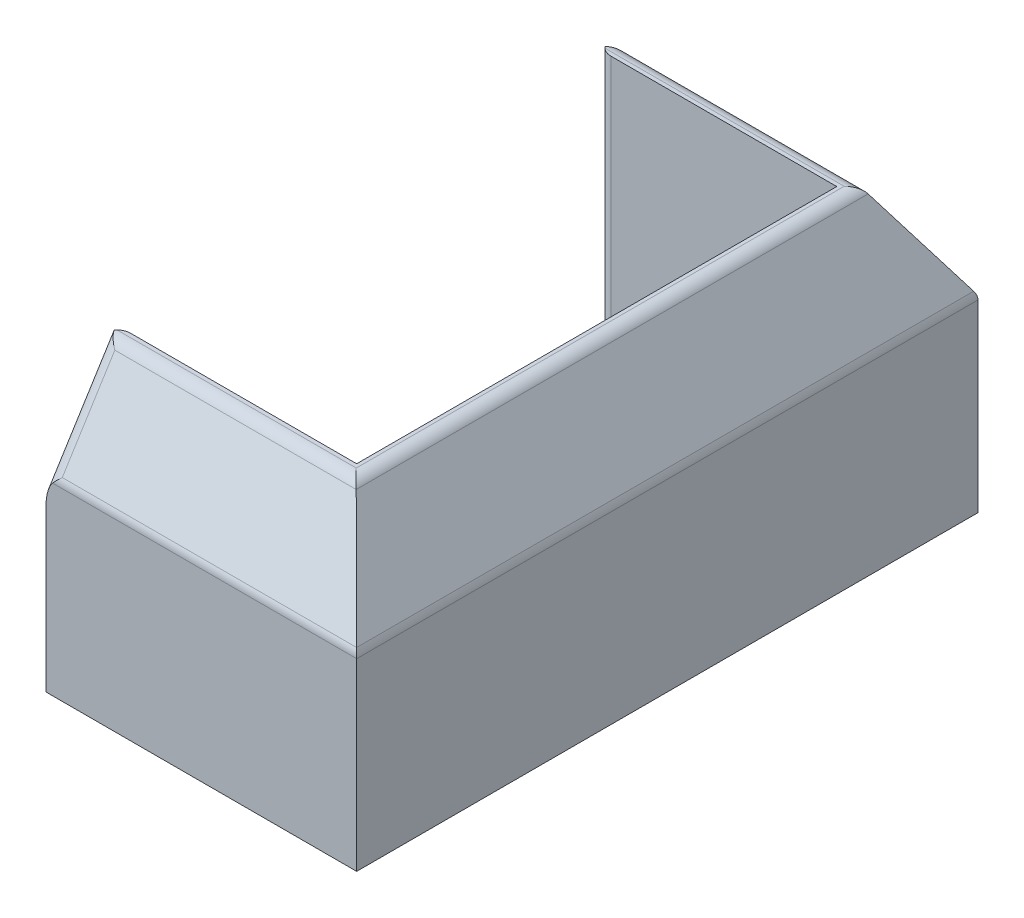
from build123d import *

# Parameters (mm, degrees)
BOSS_EXTRUDE1_DEPTH = 10.16
SKETCH2_W           = 11.43
SKETCH2_H           = 11.43
SKETCH2_R           = 2
BOSS_EXTRUDE2_DEPTH = 2.54
FILLET2_R           = 0.762


with BuildPart() as part:
    # Sketch1 → Boss-Extrude1 (new body)
    with BuildSketch(Plane(origin=(0, 0, 0), x_dir=(1, 0, 0), z_dir=(0, 1, 0))):
        Polygon((0, 0), (0, 16.764), (-3.81, 16.764), (-3.81, 3.81), (-16.764, 3.81), (-16.764, 0), align=None)
    extrude(amount=BOSS_EXTRUDE1_DEPTH)

    # Sketch2 → Boss-Extrude2 (add)
    with BuildSketch(Plane(origin=(0, 0, 0), x_dir=(1, 0, 0), z_dir=(0, 1, 0))):
        with Locations((-5.715, 5.715)):
            Rectangle(SKETCH2_W, SKETCH2_H)
        with Locations(Location((-7.874, 7.874, 0), (0, 0, 270))):
            Circle(SKETCH2_R, mode=Mode.SUBTRACT)
    extrude(amount=BOSS_EXTRUDE2_DEPTH)

    # Sketch3 → section 1 of loft3
    with BuildSketch(Plane(origin=(0, 15.24, 0), x_dir=(1, 0, 0), z_dir=(0, 1, 0)), mode=Mode.PRIVATE) as loft3_s1:
        with BuildLine():
            Line((-3.2004, 3.175), (-3.2004, 16.764))
            Line((-3.2004, 16.764), (-3.81, 16.764))
            Line((-3.81, 16.764), (-3.81, 3.81))
            Line((-3.81, 3.81), (-16.764, 3.81))
            Line((-16.764, 3.81), (-16.764, 3.175))
            Line((-16.764, 3.175), (-3.2004, 3.175))
        make_face()
    # loft from a face of the part (loft3)
    loft([part.faces().sort_by_distance((-0.237078762, 10.16, -8.382))[0], loft3_s1.sketch])

    # Mirror4: part across plane


with BuildPart() as part_1:
    add(part.part)
    add(part.part.mirror(Plane(origin=(0, 10.16, -16.764), x_dir=(1, 0, 0), z_dir=(0, 0, 1))))

    # Fillet2
    # the kernel refuses this fillet: 0.762 mm, written as the material it takes off along each edge
    with BuildSketch(Plane(origin=(-16.764, -1.905, -3.81), x_dir=(0, 0, 1), z_dir=(0, 1, 0)), Plane(origin=(-16.764, -1.905, -29.718), x_dir=(1, 0, 0), z_dir=(0, 1, 0))) as fillet2_piece_1:
        with BuildLine():
            CenterArc((FILLET2_R, FILLET2_R), FILLET2_R, 180, 90)
            Line((0, FILLET2_R), (0, 0))
            Line((0, 0), (FILLET2_R, 0))
        make_face()
    extrude(amount=19.05, mode=Mode.SUBTRACT)
    with BuildSketch(Plane(origin=(-11.43, -1.905, -11.43), x_dir=(0, 0, 1), z_dir=(0, 1, 0))) as fillet2_piece_2:
        with BuildLine():
            CenterArc((FILLET2_R, FILLET2_R), FILLET2_R, 180, 90)
            Line((0, FILLET2_R), (0, 0))
            Line((0, 0), (FILLET2_R, 0))
        make_face()
    extrude(amount=6.35, mode=Mode.SUBTRACT)
    with BuildSketch(Plane(origin=(-17.819841757, 15.24, -3.175), x_dir=(0, 0, -1), z_dir=(1, 0, 0)), Plane(origin=(-17.819841757, 15.24, -30.353), x_dir=(0, -0.8479983040050892, -0.5299989400031782), z_dir=(1, 0, 0))) as fillet2_piece_3:
        with BuildLine():
            CenterArc((FILLET2_R * 0.554247641507, -FILLET2_R), FILLET2_R, 90, 57.994616792)
            Line((-FILLET2_R * 0.293750662498, -FILLET2_R * 0.470001059997), (0, 0))
            Line((0, 0), (FILLET2_R * 0.554247641507, 0))
        make_face()
    extrude(amount=15.675283514, mode=Mode.SUBTRACT)
    with BuildSketch(Plane(origin=(-3.2004, 15.24, -31.404379485), x_dir=(-1, 0, 0), z_dir=(0, 0, 1))) as fillet2_piece_4:
        with BuildLine():
            CenterArc((FILLET2_R * 0.551905241549, FILLET2_R), FILLET2_R, 212.210927724, 57.789072276)
            Line((-FILLET2_R * 0.29418627649, FILLET2_R * 0.466962343635), (0, 0))
            Line((0, 0), (FILLET2_R * 0.551905241549, 0))
        make_face()
    extrude(amount=29.28075897, mode=Mode.SUBTRACT)
    with BuildSketch(Plane(origin=(-16.764, 8.544563231, 1.009647981), x_dir=(1, 0, 0), z_dir=(0, 0.847998304005088, -0.5299989400031799))) as fillet2_piece_5:
        with BuildLine():
            CenterArc((FILLET2_R, FILLET2_R), FILLET2_R, 180, 90)
            Line((0, FILLET2_R), (0, 0))
            Line((0, 0), (FILLET2_R, 0))
        make_face()
    extrude(amount=9.800578019, mode=Mode.SUBTRACT)
    with BuildSketch(Plane(origin=(-17.310346811, 10.16, 0), x_dir=(0, 0.8479983040050875, -0.5299989400031807), z_dir=(1, 0, 0)), Plane(origin=(-17.310346811, 10.16, -33.528), x_dir=(0, -1, 0), z_dir=(1, 0, 0))) as fillet2_piece_6:
        with BuildLine():
            CenterArc((FILLET2_R * 0.286796226411, -FILLET2_R), FILLET2_R, 90, 32.005383208)
            Line((-FILLET2_R * 0.243202713592, -FILLET2_R * 0.152001695995), (0, 0))
            Line((0, 0), (FILLET2_R * 0.286796226411, 0))
        make_face()
    extrude(amount=17.856693623, mode=Mode.SUBTRACT)
    with BuildSketch(Plane(origin=(-11.43, -1.905, -22.098), x_dir=(0, 0, -1), z_dir=(0, 1, 0))) as fillet2_piece_7:
        with BuildLine():
            CenterArc((FILLET2_R, -FILLET2_R), FILLET2_R, 90, 90)
            Line((0, -FILLET2_R), (0, 0))
            Line((0, 0), (FILLET2_R, 0))
        make_face()
    extrude(amount=6.35, mode=Mode.SUBTRACT)
    with BuildSketch(Plane(origin=(-16.764, 8.544563231, -34.537647981), x_dir=(1, 0, 0), z_dir=(0, 0.847998304005088, 0.5299989400031797))) as fillet2_piece_8:
        with BuildLine():
            CenterArc((FILLET2_R, -FILLET2_R), FILLET2_R, 90, 90)
            Line((0, -FILLET2_R), (0, 0))
            Line((0, 0), (FILLET2_R, 0))
        make_face()
    extrude(amount=9.800578019, mode=Mode.SUBTRACT)
    with BuildSketch(Plane(origin=(0, 10.16, -34.078046802), x_dir=(0, -1, 0), z_dir=(0, 0, 1))) as fillet2_piece_9:
        with BuildLine():
            CenterArc((FILLET2_R * 0.288738478649, -FILLET2_R), FILLET2_R, 90, 32.210927724)
            Line((-FILLET2_R * 0.244299177716, -FILLET2_R * 0.153908481961), (0, 0))
            Line((0, 0), (FILLET2_R * 0.288738478649, 0))
        make_face()
    extrude(amount=34.628093604, mode=Mode.SUBTRACT)


solid = part_1.part
